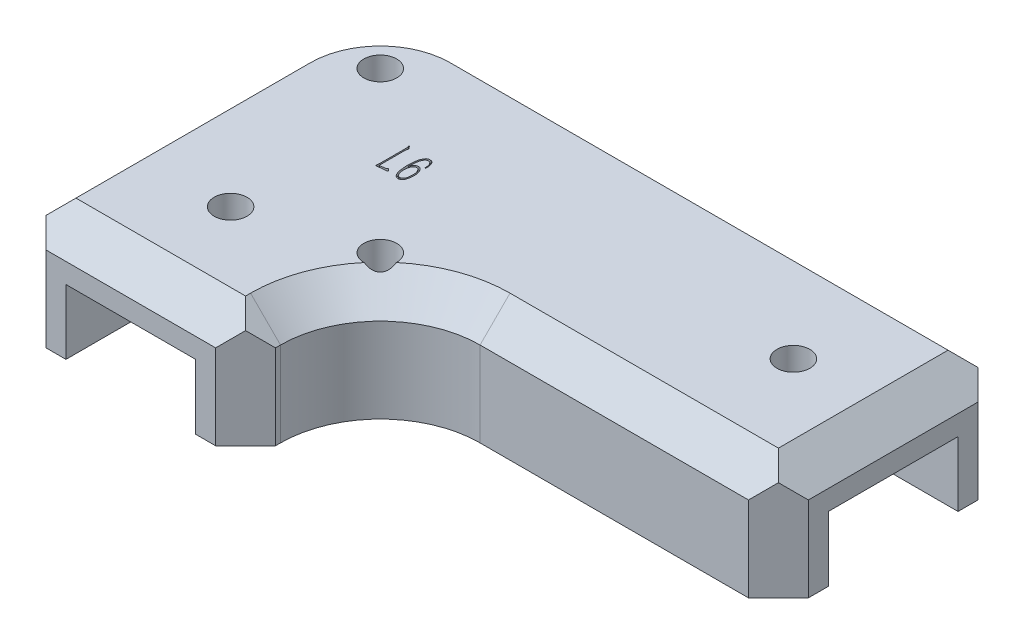
from build123d import *

# Parameters (mm, degrees)
SKETCH_1_W          = 23
SKETCH_1_H          = 23
SKETCH_1_W_2        = 13
SKETCH_1_H_2        = 13
EXTRUDE_1_DEPTH     = 36.5
SKETCH_2_R          = 1.65
CUT_EXTRUDE_1_DEPTH = 34
SKETCH_4_W          = 23
SKETCH_4_H          = 23
SKETCH_4_R          = 3
EXTRUDE_2_DEPTH     = 29.9
SKETCH_5_W          = 23
SKETCH_5_H          = 23
SKETCH_5_W_2        = 13
SKETCH_5_H_2        = 13
EXTRUDE_1_2_DEPTH   = 10
SKETCH_6_R          = 1.65
CUT_EXTRUDE_2_DEPTH = 39
SKETCH_7_W          = 13
SKETCH_7_H          = 13
CUT_EXTRUDE_3_DEPTH = 39.4
CHAMFER_1_SIZE      = 3
SKETCH_8_W          = 62.9
SKETCH_8_H          = 36.5
CUT_EXTRUDE_4_DEPTH = 11.5
EXTRUDE_3_DEPTH     = 6.5
FILLET_1_R          = 10
FILLET_2_R          = 10
SKETCH_10_R         = 1.65
CUT_EXTRUDE_5_DEPTH = 28.5
CHAMFER_3_SIZE      = 3
CHAMFER_4_SIZE      = 3
CHAMFER_5_SIZE      = 3
CUT_EXTRUDE_6_DEPTH = 0.3


with BuildPart() as part:
    # 草图1 → Extrude 1 (new body)
    with BuildSketch(Plane.XY):
        with Locations((6.5, 6.5)):
            Rectangle(SKETCH_1_W, SKETCH_1_H)
        with Locations((6.5, 6.5)):
            Rectangle(SKETCH_1_W_2, SKETCH_1_H_2, mode=Mode.SUBTRACT)
    extrude(amount=EXTRUDE_1_DEPTH)

    # 草图2 → 切除-拉伸1 (cut)
    with BuildSketch(Plane.XZ.offset(5)):
        with Locations(Location((6.5, 26.5, 0), (0, 0, 270))):
            Circle(SKETCH_2_R)
    extrude(amount=-CUT_EXTRUDE_1_DEPTH, mode=Mode.SUBTRACT)

    # 草图4 → 凸台-拉伸2 (add)
    with BuildSketch(Plane(origin=(18, 0, 0), x_dir=(0, 0, -1), z_dir=(1, 0, 0))):
        with Locations((-11.5, 6.5)):
            Rectangle(SKETCH_4_W, SKETCH_4_H)
        with Locations(Location((-11.5, 6.5, 0), (0, 0, 90))):
            Circle(SKETCH_4_R, mode=Mode.SUBTRACT)
    extrude(amount=EXTRUDE_2_DEPTH)

    # 草图5 → Extrude 1 2 (add)
    with BuildSketch(Plane(origin=(47.9, 0, 0), x_dir=(0, 0, -1), z_dir=(1, 0, 0))):
        with Locations((-11.5, 6.5)):
            Rectangle(SKETCH_5_W, SKETCH_5_H)
        with Locations((-11.5, 6.5)):
            Rectangle(SKETCH_5_W_2, SKETCH_5_H_2, mode=Mode.SUBTRACT)
    extrude(amount=EXTRUDE_1_2_DEPTH)

    # 草图6 → 切除-拉伸2 (cut)
    with BuildSketch(Plane(origin=(0, 18, 0), x_dir=(1, 0, 0), z_dir=(0, 1, 0))):
        with Locations(Location((47.9, -11.5, 0), (0, 0, 270))):
            Circle(SKETCH_6_R)
    extrude(amount=-CUT_EXTRUDE_2_DEPTH, mode=Mode.SUBTRACT)

    # 草图7 → 切除-拉伸3 (cut)
    with BuildSketch(Plane(origin=(47.9, 0, 0), x_dir=(0, 0, -1), z_dir=(1, 0, 0))):
        with Locations((-11.5, 6.5)):
            Rectangle(SKETCH_7_W, SKETCH_7_H)
    extrude(amount=-CUT_EXTRUDE_3_DEPTH, mode=Mode.SUBTRACT)

    # 倒角1
    chamfer_1_edges = [part.edges().sort_by_distance(p)[0] for p in [
        (13, 6.5, 18),
    ]]
    chamfer(chamfer_1_edges, length=CHAMFER_1_SIZE)

    # 草图8 → 切除-拉伸4 (cut)
    with BuildSketch(Plane.XZ.offset(5)):
        with Locations((26.45, 18.25)):
            Rectangle(SKETCH_8_W, SKETCH_8_H)
    extrude(amount=-CUT_EXTRUDE_4_DEPTH, mode=Mode.SUBTRACT)

    # 草图9 → 凸台-拉伸3 (add)
    with BuildSketch(Plane.XZ.offset(-13)):
        Polygon((13, 5), (0, 18), (0, 0), (13, 0), align=None)
    extrude(amount=EXTRUDE_3_DEPTH)

    # 圆角1
    fillet_1_edges = [part.edges().sort_by_distance(p)[0] for p in [
        (-5, 12.25, 0),
    ]]
    fillet(fillet_1_edges, radius=FILLET_1_R)

    # 圆角2
    fillet_2_edges = [part.edges().sort_by_distance(p)[0] for p in [
        (18, 12.25, 23),
    ]]
    fillet(fillet_2_edges, radius=FILLET_2_R)

    # 草图10 → 切除-拉伸5 (cut)
    with BuildSketch(Plane.XZ.offset(-6.5)):
        with Locations(Location((2, 7, 0), (0, 0, 270))):
            Circle(SKETCH_10_R)
        with Locations(Location((18, 23, 0), (0, 0, 270))):
            Circle(SKETCH_10_R)
    extrude(amount=-CUT_EXTRUDE_5_DEPTH, mode=Mode.SUBTRACT)

    # 倒角3
    # the kernel refuses this chamfer: 3 mm, written as the material it takes off along each edge
    with BuildSketch(Plane(origin=(5, 18, 10), x_dir=(0, 0, -1), z_dir=(1, 0, 0))) as chamfer_3_piece_1:
        Polygon((10 - CHAMFER_3_SIZE, 0), (10, -CHAMFER_3_SIZE), (10, 0), align=None)
    revolve(axis=Axis((5, 18, 10), (0, 1, 0)), revolution_arc=90, mode=Mode.SUBTRACT)
    with BuildSketch(Plane(origin=(28, 18, 33), x_dir=(-1, 0, 0), z_dir=(0, 0, 1))) as chamfer_3_piece_2:
        Polygon((10 + CHAMFER_3_SIZE, 0), (10, CHAMFER_3_SIZE), (10, 0), align=None)
    revolve(axis=Axis((28, 18, 33), (0, -1, 0)), revolution_arc=90, mode=Mode.SUBTRACT)
    with BuildSketch(Plane(origin=(28, 18, 23), x_dir=(0, 0.027495876610586768, -0.9996219169112968), z_dir=(1, 0, 0))) as chamfer_3_piece_3:
        Polygon((CHAMFER_3_SIZE * 0.999621916911, -CHAMFER_3_SIZE * 0.0274958766106), (-CHAMFER_3_SIZE * 0.0274958766106, -CHAMFER_3_SIZE * 0.999621916911), (0, 0), align=None)
    extrude(amount=37.615048964, mode=Mode.SUBTRACT)
    with BuildSketch(Plane(origin=(65.615048964, 18, 0), x_dir=(0, 0.027495876610586778, 0.9996219169112968), z_dir=(-1, 0, 0))) as chamfer_3_piece_4:
        Polygon((CHAMFER_3_SIZE * 0.999621916911, -CHAMFER_3_SIZE * 0.0274958766106), (-CHAMFER_3_SIZE * 0.0274958766106, -CHAMFER_3_SIZE * 0.999621916911), (0, 0), align=None)
    extrude(amount=60.615048964, mode=Mode.SUBTRACT)
    with BuildSketch(Plane(origin=(-5, 18, 10), x_dir=(0.9996219169112968, 0.027495876610586778, 0), z_dir=(0, 0, 1))) as chamfer_3_piece_5:
        Polygon((CHAMFER_3_SIZE * 0.999621916911, -CHAMFER_3_SIZE * 0.0274958766106), (-CHAMFER_3_SIZE * 0.0274958766106, -CHAMFER_3_SIZE * 0.999621916911), (0, 0), align=None)
    extrude(amount=34.215048964, mode=Mode.SUBTRACT)
    with BuildSketch(Plane(origin=(18, 18, 33), x_dir=(-0.9996219169112968, 0.02749587661058678, 0), z_dir=(0, 0, 1))) as chamfer_3_piece_6:
        Polygon((CHAMFER_3_SIZE * 0.999621916911, CHAMFER_3_SIZE * 0.0274958766106), (-CHAMFER_3_SIZE * 0.0274958766106, CHAMFER_3_SIZE * 0.999621916911), (0, 0), align=None)
    extrude(amount=11.215048964, mode=Mode.SUBTRACT)

    # 倒角4
    chamfer_4_edges = [part.edges().sort_by_distance(p)[0] for p in [
        (57.9, 18, 11.5),
        (6.5, 18, 36.5),
    ]]
    chamfer(chamfer_4_edges, length=CHAMFER_4_SIZE)

    # 倒角5
    chamfer_5_edges = [part.edges().sort_by_distance(p)[0] for p in [
        (57.9, 10.75, 0),
        (18, 10.75, 36.5),
        (-5, 10.75, 36.5),
        (57.9, 10.75, 23),
    ]]
    chamfer(chamfer_5_edges, length=CHAMFER_5_SIZE)

    # 草图11 → 切除-拉伸6 (cut)
    # profile 1 of 2: a face of its own
    with BuildSketch(Plane(origin=(0, 18, 0), x_dir=(1, 0, 0), z_dir=(0, 1, 0))):
        with BuildLine():
            Line((10.169961689, -12.331537965), (10.205013894, -12.291265218))
            Line((10.205013894, -12.291265218), (10.426514001, -12.567953904))
            add(Edge.make_bspline(
                [(10.426514001, -12.567953904), (10.420112222, -12.579915965), (10.407467454, -12.603543377), (10.386569123, -12.639943921), (10.370185964, -12.685502621), (10.359588371, -12.742805909), (10.35209593, -12.811137632), (10.351500935, -12.860031707), (10.351189049, -12.885661127)],
                knots=[0, 0, 0, 0, 0.736410598, 1.454555069, 2.274010016, 3.348139226, 4.609940921, 6, 6, 6, 6], degree=3))
            Line((10.351189049, -12.885661127), (10.351189049, -15.45267583))
            add(Edge.make_bspline(
                [(10.351189049, -15.45267583), (10.371826596, -15.452896348), (10.409627863, -15.453300265), (10.460307316, -15.45086352), (10.499898624, -15.451081152), (10.532243392, -15.448383736), (10.566728187, -15.443767174), (10.611448589, -15.437841115), (10.671205536, -15.430596017), (10.740781303, -15.42063203), (10.811376358, -15.410141046), (10.873070645, -15.400698583), (10.921027088, -15.392273183), (10.96613794, -15.38446762), (11.010436775, -15.369094836), (11.049310442, -15.340736904), (11.074303969, -15.311966685), (11.093758709, -15.304642687), (11.100709611, -15.302025926)],
                knots=[0, 0, 0, 0, 1.271684107, 2.329311289, 3.126176351, 3.710204741, 4.32783396, 5.270448411, 6.49050515, 8.03759688, 9.602040843, 10.889228832, 11.884182716, 12.602334394, 13.712376462, 14.732953672, 15.547302315, 16, 16, 16, 16], degree=3))
            add(Edge.make_bspline(
                [(11.100709611, -15.302025926), (11.103959736, -15.304489051), (11.113400688, -15.311643929), (11.132267838, -15.327898493), (11.163548601, -15.353676179), (11.201478257, -15.390427651), (11.240409179, -15.42644517), (11.271376905, -15.455066249), (11.293619074, -15.475482172), (11.302231693, -15.496622164), (11.305824587, -15.513703571), (11.306858546, -15.523764644), (11.307293886, -15.528000782)],
                knots=[0, 0, 0, 0, 0.390394386, 1.134016561, 2.38360509, 4.269889804, 6.18981564, 7.453157385, 8.329021544, 9.032311711, 9.592562279, 10, 10, 10, 10], degree=3))
            add(Edge.make_bspline(
                [(11.307293886, -15.528000782), (11.305212221, -15.532796655), (11.301026913, -15.542439033), (11.286239348, -15.55179173), (11.267131043, -15.556758669), (11.233888241, -15.556197885), (11.186258933, -15.554623782), (11.124477681, -15.564210462), (11.05816542, -15.573408269), (11.005527492, -15.581639095), (10.965535977, -15.587447027), (10.936371989, -15.590018683), (10.899642796, -15.594141501), (10.855080644, -15.59744449), (10.802889633, -15.602073636), (10.742973465, -15.607248202), (10.67539132, -15.613397762), (10.627634367, -15.617061001), (10.60252082, -15.618987358)],
                knots=[0, 0, 0, 0, 0.341365878, 0.68633572, 1.116730632, 1.647491765, 2.890856209, 4.29325764, 5.800779701, 7.359923239, 7.845242571, 8.495183841, 9.311733456, 10.309872826, 11.474601469, 12.805924266, 14.320358265, 16, 16, 16, 16], degree=3))
            Line((10.60252082, -15.618987358), (10.391461796, -15.639123731))
            Line((10.391461796, -15.639123731), (10.275118305, -15.648819022))
            add(Edge.make_bspline(
                [(10.275118305, -15.648819022), (10.263007492, -15.652765111), (10.243378711, -15.659160794), (10.214432, -15.655040492), (10.201866673, -15.638282344), (10.192131638, -15.619901093), (10.192866545, -15.591243902), (10.198261256, -15.551485761), (10.205237773, -15.496760287), (10.208454509, -15.455416407), (10.210234436, -15.432539457)],
                knots=[0, 0, 0, 0, 1.058270145, 1.715207142, 2.242218181, 2.723015089, 3.427046488, 4.550153686, 6.091084828, 8, 8, 8, 8], degree=3))
            Line((10.210234436, -15.432539457), (10.219929727, -15.135714398))
            Line((10.219929727, -15.135714398), (10.219929727, -12.869999504))
            add(Edge.make_bspline(
                [(10.219929727, -12.869999504), (10.220035325, -12.841906978), (10.220225034, -12.791438493), (10.219121537, -12.724573471), (10.218920574, -12.674829063), (10.216657144, -12.63033937), (10.213948744, -12.583085364), (10.209857543, -12.52449073), (10.200503917, -12.456208353), (10.187043548, -12.40845637), (10.17965698, -12.382251794)],
                knots=[0, 0, 0, 0, 1.372323329, 2.465391677, 3.267017655, 3.801925377, 4.641299591, 5.579257235, 6.671583216, 8, 8, 8, 8], degree=3))
            Line((10.17965698, -12.382251794), (10.169961689, -12.331537965))
        make_face()
    # profile 2 of 2: a face of its own
    with BuildSketch(Plane(origin=(0, 18, 0), x_dir=(1, 0, 0), z_dir=(0, 1, 0))):
        with BuildLine():
            Line((12.942814875, -13.383849919), (12.872710464, -13.383849919))
            add(Edge.make_bspline(
                [(12.872710464, -13.383849919), (12.867918886, -13.353809877), (12.858438492, -13.294374035), (12.849706726, -13.203550372), (12.83905791, -13.109176046), (12.820825233, -13.009319563), (12.79213831, -12.905502921), (12.751787805, -12.822970037), (12.713616192, -12.761128168), (12.681074416, -12.719772821), (12.643740897, -12.68513145), (12.60383766, -12.655968298), (12.560867121, -12.633421198), (12.515816463, -12.617151626), (12.46800517, -12.609872771), (12.419341648, -12.610331281), (12.37196, -12.615849571), (12.327948721, -12.627325085), (12.288264417, -12.642859648), (12.251427379, -12.663429677), (12.217626053, -12.693175443), (12.182369113, -12.73045195), (12.147000859, -12.779042444), (12.109980412, -12.836434778), (12.074100881, -12.903470073), (12.042445574, -12.979778402), (12.014177787, -13.064293467), (11.981349351, -13.189191417), (11.950908708, -13.356894625), (11.932652427, -13.528473707), (11.924020532, -13.663229848), (11.919736569, -13.753495496), (11.916223971, -13.831794896), (11.915974323, -13.880046822), (11.915859835, -13.902175084)],
                knots=[0, 0, 0, 0, 1.172618578, 2.320089015, 3.517365984, 4.833421129, 6.231766425, 7.655217032, 8.357323983, 9.032478261, 9.676711985, 10.315215253, 10.932648665, 11.54199308, 12.153444918, 12.786093219, 13.413857257, 13.988112725, 14.53457488, 15.054145165, 15.605211832, 16.262994999, 17.029841423, 17.917944275, 18.895673466, 19.956732694, 21.09950916, 22.329492637, 24.933332206, 27.662278065, 28.97833321, 30.139613505, 31.146829503, 32, 32, 32, 32], degree=3))
            Line((11.915859835, -13.902175084), (11.911385086, -14.098318276))
            add(Edge.make_bspline(
                [(11.911385086, -14.098318276), (11.923834505, -14.063189828), (11.946336992, -13.999694701), (11.980887158, -13.912091477), (12.020008929, -13.837807929), (12.065615005, -13.769118356), (12.124632618, -13.705721256), (12.184922335, -13.659402751), (12.241612947, -13.627387084), (12.291956123, -13.609038819), (12.348639061, -13.596364249), (12.388627507, -13.592472653), (12.409573877, -13.590434194)],
                knots=[0, 0, 0, 0, 1.463710204, 2.645675197, 3.693667506, 4.755032446, 5.874045908, 7.078730407, 7.725382873, 8.423483439, 9.174203962, 10, 10, 10, 10], degree=3))
            add(Edge.make_bspline(
                [(12.409573877, -13.590434194), (12.439835126, -13.591591348), (12.497383672, -13.593791936), (12.580232678, -13.618560704), (12.657683928, -13.662024086), (12.717344383, -13.715168011), (12.765506198, -13.767614813), (12.800980306, -13.815640946), (12.83559675, -13.86996529), (12.880092113, -13.951367182), (12.928072791, -14.062381272), (12.96274157, -14.181006946), (12.980750115, -14.281516051), (12.992492769, -14.362531543), (12.998711178, -14.448994823), (13.002334613, -14.569872825), (13.000558726, -14.720743995), (12.992331534, -14.840657004), (12.988308163, -14.899298459)],
                knots=[0, 0, 0, 0, 0.909148716, 1.728949998, 2.576991438, 3.564625719, 4.121218537, 4.72026629, 5.360049571, 6.060456872, 7.512703724, 8.993852322, 9.770776208, 10.587253518, 11.458483217, 12.380006039, 14.229702395, 16, 16, 16, 16], degree=3))
            add(Edge.make_bspline(
                [(12.988308163, -14.899298459), (12.983608116, -14.929675901), (12.973860322, -14.992678041), (12.953205559, -15.089864753), (12.927868491, -15.19309581), (12.898759968, -15.298586031), (12.865056127, -15.398748972), (12.820466317, -15.484106806), (12.766539325, -15.551118503), (12.70422983, -15.597317433), (12.642693157, -15.627760558), (12.587657462, -15.651328091), (12.539752875, -15.66833624), (12.509108536, -15.672365551), (12.495339912, -15.674175937)],
                knots=[0, 0, 0, 0, 1.110217054, 2.302565578, 3.587623031, 4.949459538, 6.256081064, 7.397105523, 8.411240029, 9.334418742, 10.173869837, 10.886090718, 11.499516107, 12, 12, 12, 12], degree=3))
            add(Edge.make_bspline(
                [(12.495339912, -15.674175937), (12.470213796, -15.676282338), (12.420118214, -15.68048201), (12.35684791, -15.668988814), (12.306109765, -15.651276018), (12.264992877, -15.630107878), (12.219298731, -15.604464513), (12.171688318, -15.57097854), (12.123314851, -15.532029135), (12.080029096, -15.483908729), (12.040141389, -15.430188824), (11.994152314, -15.348900857), (11.945784339, -15.241043373), (11.900910188, -15.129057625), (11.872023575, -15.029968363), (11.852437657, -14.941217661), (11.833916104, -14.838201609), (11.817915581, -14.725910345), (11.803798949, -14.614957849), (11.791998912, -14.515471595), (11.782018513, -14.432747788), (11.772938084, -14.34482367), (11.766603475, -14.247085007), (11.764555812, -14.131880233), (11.766516457, -14.010541481), (11.7690752, -13.926534252), (11.770430472, -13.882038711)],
                knots=[0, 0, 0, 0, 0.848219995, 1.691151707, 2.144998995, 2.659153853, 3.249319417, 3.912736756, 4.621867519, 5.340468245, 6.090710837, 6.87657341, 8.487178015, 10.078339935, 10.944022033, 11.968008362, 13.14490399, 14.476453821, 15.796264219, 16.920399402, 17.85823784, 18.608902694, 19.903936842, 21.162934464, 22.497310667, 24, 24, 24, 24], degree=3))
            add(Edge.make_bspline(
                [(11.770430472, -13.882038711), (11.771327858, -13.846485859), (11.773016259, -13.779594321), (11.776837417, -13.685624172), (11.780784559, -13.604510622), (11.789230244, -13.511458816), (11.803144805, -13.39744376), (11.825085762, -13.25792114), (11.850828027, -13.117956151), (11.878891146, -13.005409005), (11.905895261, -12.919269954), (11.931277234, -12.853378891), (11.963178755, -12.785907457), (11.997835599, -12.716461615), (12.0374126, -12.650488401), (12.080994362, -12.591165841), (12.128035304, -12.541079834), (12.178389948, -12.498680209), (12.235228677, -12.466647739), (12.298659551, -12.444011953), (12.369607576, -12.432284686), (12.418981842, -12.432242001), (12.444626083, -12.432219832)],
                knots=[0, 0, 0, 0, 1.211628523, 2.279639787, 3.204225299, 3.977932759, 5.462339825, 7.116605252, 8.789327199, 10.30942825, 11.064792467, 11.863814246, 12.712679163, 13.606614715, 14.50718602, 15.330439464, 16.109367713, 16.843542067, 17.564206182, 18.319665359, 19.127259812, 20, 20, 20, 20], degree=3))
            add(Edge.make_bspline(
                [(12.444626083, -12.432219832), (12.47061728, -12.434371472), (12.519733425, -12.438437474), (12.587433315, -12.456871949), (12.64558744, -12.481350088), (12.691625485, -12.516048591), (12.727754813, -12.554311881), (12.761140383, -12.589067483), (12.787400935, -12.624285691), (12.810241334, -12.658831833), (12.829130287, -12.697187767), (12.848050578, -12.740562468), (12.865551481, -12.791607385), (12.882564162, -12.847431062), (12.898444852, -12.903639632), (12.911970266, -12.955836672), (12.922441107, -13.001847585), (12.93303939, -13.057349854), (12.941823915, -13.13025522), (12.942465646, -13.190159282), (12.942814875, -13.222758932)],
                knots=[0, 0, 0, 0, 1.358046768, 2.566331314, 3.646368544, 4.629682629, 5.546946845, 6.391627168, 7.141431054, 7.835891544, 8.549473584, 9.368770778, 10.304200405, 11.362836174, 12.414134618, 13.351720444, 14.176238426, 14.875889185, 16.299866179, 18, 18, 18, 18], degree=3))
            Line((12.942814875, -13.222758932), (12.942814875, -13.383849919))
        make_face()
        with BuildLine():
            add(Edge.make_bspline(
                [(11.976268955, -14.627084524), (11.977776853, -14.671882646), (11.980871547, -14.763822908), (11.999676029, -14.903263912), (12.032371025, -15.044733228), (12.071441669, -15.160657463), (12.110199634, -15.249260952), (12.145017863, -15.309099013), (12.182766953, -15.363622531), (12.225939236, -15.410442099), (12.273415518, -15.450201741), (12.328278603, -15.475240996), (12.387676021, -15.489995311), (12.42862973, -15.488501786), (12.449846624, -15.487728035)],
                knots=[0, 0, 0, 0, 1.4886747, 3.055242853, 4.666194597, 6.306608966, 7.112592917, 7.87485258, 8.603662743, 9.310999056, 9.986965693, 10.644668568, 11.297843225, 12, 12, 12, 12], degree=3))
            add(Edge.make_bspline(
                [(12.449846624, -15.487728035), (12.468144225, -15.485993629), (12.504818459, -15.482517324), (12.558075746, -15.463371912), (12.609279858, -15.434730143), (12.657334013, -15.395609478), (12.700988825, -15.349397119), (12.739842908, -15.29817881), (12.771242925, -15.241865727), (12.80406074, -15.159057279), (12.834334928, -15.045544046), (12.850986916, -14.899160399), (12.861238325, -14.746019568), (12.869143467, -14.5882095), (12.867353129, -14.424643744), (12.847724811, -14.315423703), (12.837658258, -14.259409263)],
                knots=[0, 0, 0, 0, 0.542441635, 1.087226227, 1.660703064, 2.273516638, 2.914006631, 3.539772715, 4.172601069, 4.816509057, 6.173746714, 7.636628278, 9.17189136, 10.71932084, 12.317475397, 14, 14, 14, 14], degree=3))
            add(Edge.make_bspline(
                [(12.837658258, -14.259409263), (12.82399313, -14.213469196), (12.796840697, -14.122186881), (12.745016517, -14.015996971), (12.696932685, -13.940158115), (12.661390115, -13.890695756), (12.621692603, -13.852576503), (12.582203855, -13.82183798), (12.540935352, -13.800372642), (12.500002975, -13.783702204), (12.45731544, -13.776497191), (12.428980465, -13.776256704), (12.414794419, -13.776136303)],
                knots=[0, 0, 0, 0, 2.076888393, 4.126750173, 5.096135134, 5.973977047, 6.759453719, 7.47553224, 8.136547057, 8.771446398, 9.384918551, 10, 10, 10, 10], degree=3))
            add(Edge.make_bspline(
                [(12.414794419, -13.776136303), (12.397510458, -13.778810286), (12.362707489, -13.784194617), (12.312564999, -13.802566768), (12.264502935, -13.829255277), (12.20627226, -13.875471723), (12.142523312, -13.940136066), (12.093239672, -14.014751967), (12.064219981, -14.080438774), (12.043430704, -14.136629411), (12.025034737, -14.20154504), (12.007945337, -14.273883659), (11.993923907, -14.353544569), (11.983427158, -14.439406041), (11.977675077, -14.531295867), (11.976747119, -14.594510755), (11.976268955, -14.627084524)],
                knots=[0, 0, 0, 0, 0.703513377, 1.416593983, 2.138698186, 2.910269809, 4.405335412, 5.780974721, 6.484987373, 7.296510348, 8.193863016, 9.202460595, 10.29132512, 11.452082192, 12.687092747, 14, 14, 14, 14], degree=3))
        make_face(mode=Mode.SUBTRACT)
    extrude(amount=-CUT_EXTRUDE_6_DEPTH, mode=Mode.SUBTRACT)


solid = part.part
